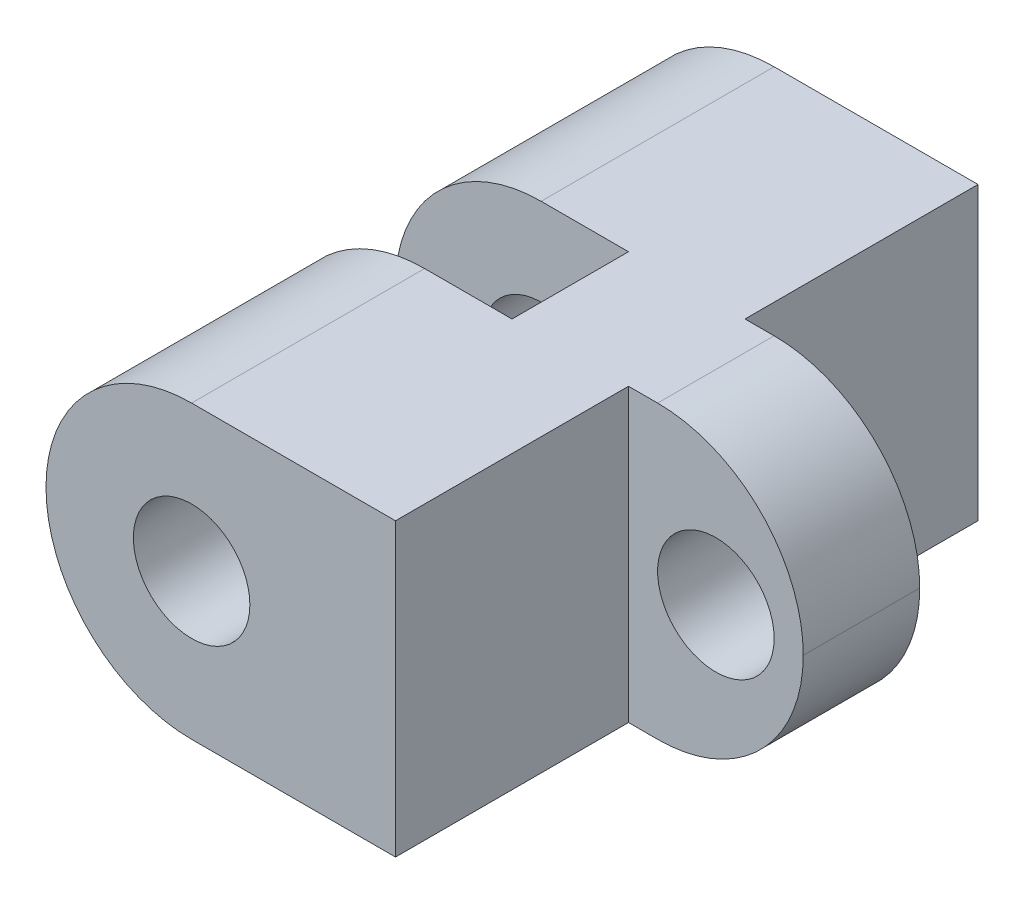
from build123d import *

# Parameters (mm, degrees)
CROQUIS1_W                 = 90
CROQUIS1_H                 = 50
SALIENTE_EXTRUIR1_DEPTH    = 100
REDONDEO1_R                = 25
CORTAR_EXTRUIR1_DEPTH      = 25
CORTAR_EXTRUIR1_DEPTH_BACK = 25
CROQUIS2_W                 = 30
CROQUIS2_H                 = 40
CROQUIS4_R                 = 10
CORTAR_EXTRUIR2_DEPTH      = 100
CROQUIS3_W                 = 40
CROQUIS3_H                 = 20
CORTAR_EXTRUIR3_DEPTH      = 50
CROQUIS5_R                 = 10
CORTAR_EXTRUIR4_DEPTH      = 20


with BuildPart() as part:
    # Croquis1 → Saliente-Extruir1 (new body)
    with BuildSketch(Plane.XY):
        Rectangle(CROQUIS1_W, CROQUIS1_H)
    extrude(amount=SALIENTE_EXTRUIR1_DEPTH)

    # Redondeo1
    redondeo1_edges = [part.edges().sort_by_distance(p)[0] for p in [
        (45, -25, 50),
        (45, 25, 50),
        (-45, -25, 50),
        (-45, 25, 50),
    ]]
    fillet(redondeo1_edges, radius=REDONDEO1_R - 0.0001)  # a hair under: the kernel refuses the full size

    # Croquis2 → Cortar-Extruir1 (cut, two sides: drawn at the far end of the back side and taken through both)
    with BuildSketch(Plane(origin=(0, 0, 0), x_dir=(1, 0, 0), z_dir=(0, 1, 0)).offset(-CORTAR_EXTRUIR1_DEPTH_BACK)):
        with Locations((30, -20)):
            Rectangle(CROQUIS2_W, CROQUIS2_H)
        with Locations((30, -80)):
            Rectangle(CROQUIS2_W, CROQUIS2_H)
    extrude(amount=CORTAR_EXTRUIR1_DEPTH + CORTAR_EXTRUIR1_DEPTH_BACK, mode=Mode.SUBTRACT)

    # Croquis4 → Cortar-Extruir2 (cut)
    with BuildSketch(Plane.XY.offset(100)):
        with Locations((-20, 0)):
            Circle(CROQUIS4_R)
    extrude(amount=-CORTAR_EXTRUIR2_DEPTH, mode=Mode.SUBTRACT)

    # Croquis3 → Cortar-Extruir3 (cut)
    with BuildSketch(Plane(origin=(0, 25, 0), x_dir=(1, 0, 0), z_dir=(0, 1, 0))):
        with Locations((-25, -50)):
            Rectangle(CROQUIS3_W, CROQUIS3_H)
    extrude(amount=-CORTAR_EXTRUIR3_DEPTH, mode=Mode.SUBTRACT)

    # Croquis5 → Cortar-Extruir4 (cut)
    with BuildSketch(Plane.XY.offset(60)):
        with Locations((30, 0)):
            Circle(CROQUIS5_R)
    extrude(amount=-CORTAR_EXTRUIR4_DEPTH, mode=Mode.SUBTRACT)


solid = part.part
